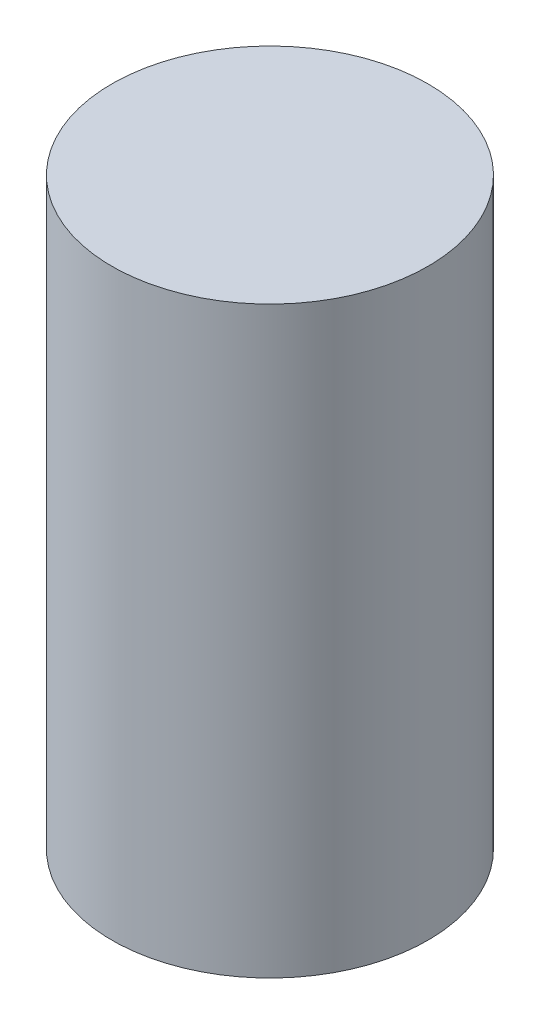
from build123d import *

# Parameters (mm, degrees)
SKETCH1_R           = 20.6375
BOSS_EXTRUDE1_DEPTH = 76.2
SKETCH2_R           = 3.175
CUT_EXTRUDE1_DEPTH  = 6.35


with BuildPart() as part:
    # Sketch1 → Boss-Extrude1 (new body)
    with BuildSketch(Plane(origin=(0, 0, 0), x_dir=(1, 0, 0), z_dir=(0, 1, 0))):
        Circle(SKETCH1_R)
    extrude(amount=BOSS_EXTRUDE1_DEPTH)

    # Sketch2 → Cut-Extrude1 (cut)
    with BuildSketch(Plane.XZ):
        with Locations((-10.16, 0)):
            Circle(SKETCH2_R)
        with Locations((10.16, 0)):
            Circle(SKETCH2_R)
    extrude(amount=-CUT_EXTRUDE1_DEPTH, mode=Mode.SUBTRACT)


solid = part.part
